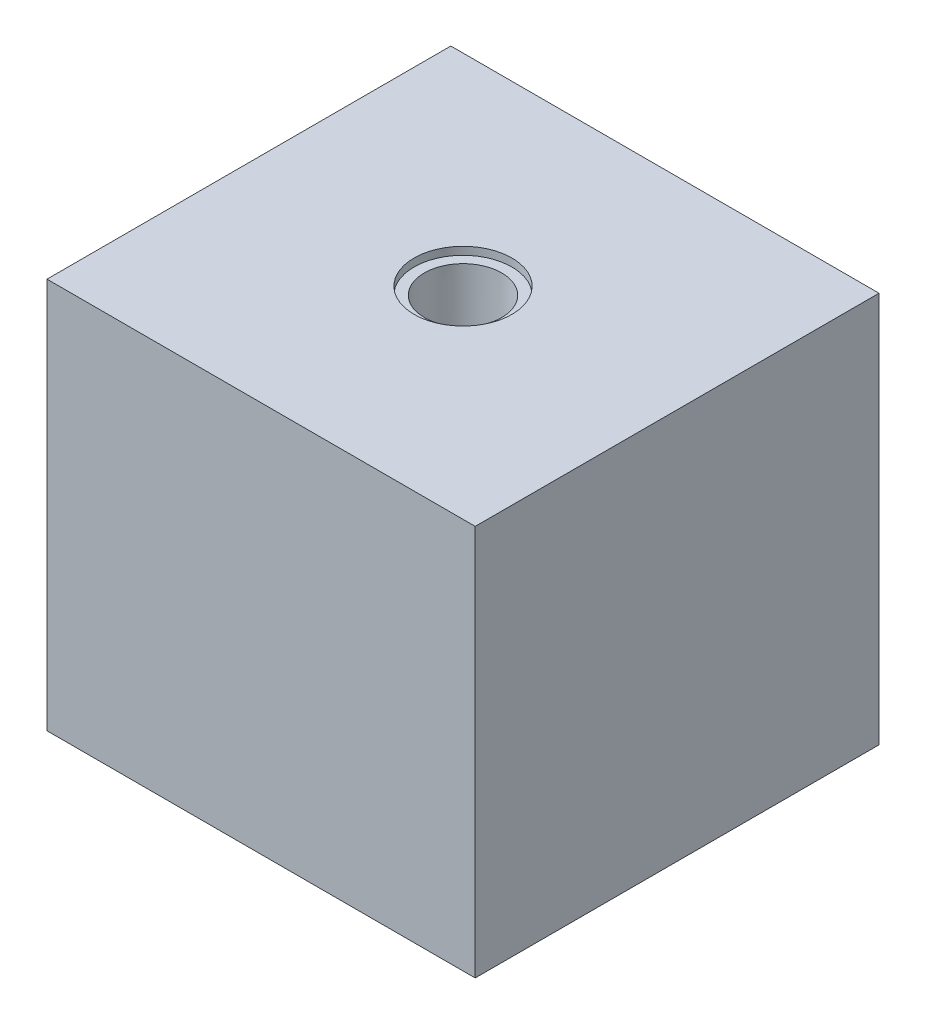
from build123d import *

# Parameters (mm, degrees)
SKETCH1_W           = 109.475312552
SKETCH1_H           = 103.242807134
BOSS_EXTRUDE1_DEPTH = 100


# Read off the part's stored shape, not the designer's step: AdvancedHole2
with BuildPart() as part:
    # Sketch1 → Boss-Extrude1 (new body)
    with BuildSketch(Plane(origin=(0, 0, 0), x_dir=(1, 0, 0), z_dir=(0, 1, 0))):
        Rectangle(SKETCH1_W, SKETCH1_H)
    extrude(amount=BOSS_EXTRUDE1_DEPTH)

    # AdvancedHole2 outline → AdvancedHole2 (revolve, cut)
    with BuildSketch(Plane.XY):
        Polygon((9.8965, 98), (12.5, 98), (12.5, 100), (0, 100), (0, 0), (6, 0), (6, 83), (9.428250684, 83), align=None)
    revolve(axis=Axis((0, 0, 0), (0, 1, 0)), mode=Mode.SUBTRACT)


solid = part.part
